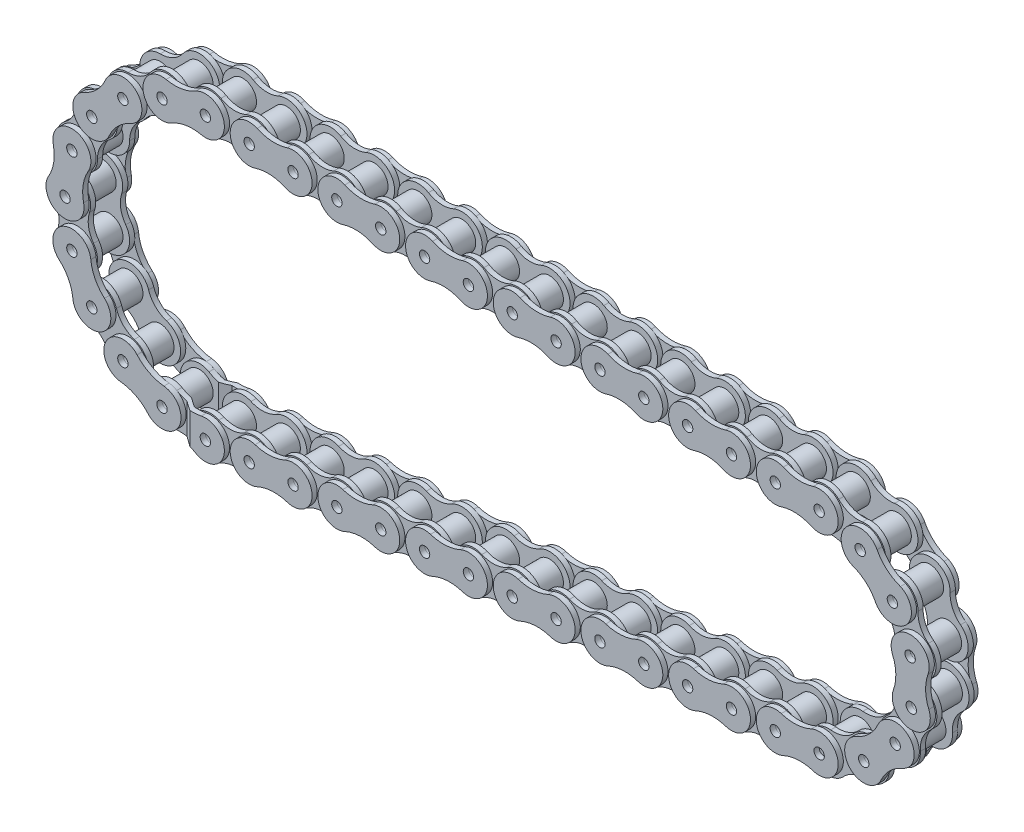
from build123d import *

# Parameters (mm, degrees)
SKETCH4_R              = 4
BOSS_EXTRUDE1_DEPTH    = 3.9
BOSS_EXTRUDE1_2_DEPTH  = 3.9
BOSS_EXTRUDE1_3_DEPTH  = 3.9
BOSS_EXTRUDE1_4_DEPTH  = 3.9
BOSS_EXTRUDE1_5_DEPTH  = 3.9
BOSS_EXTRUDE1_6_DEPTH  = 3.9
BOSS_EXTRUDE1_7_DEPTH  = 3.9
BOSS_EXTRUDE1_8_DEPTH  = 3.9
BOSS_EXTRUDE1_9_DEPTH  = 3.9
BOSS_EXTRUDE1_10_DEPTH = 3.9
BOSS_EXTRUDE1_11_DEPTH = 3.9
BOSS_EXTRUDE1_12_DEPTH = 3.9
BOSS_EXTRUDE1_13_DEPTH = 3.9
BOSS_EXTRUDE1_14_DEPTH = 3.9
BOSS_EXTRUDE1_15_DEPTH = 3.9
BOSS_EXTRUDE1_16_DEPTH = 3.9
BOSS_EXTRUDE1_17_DEPTH = 3.9
BOSS_EXTRUDE1_18_DEPTH = 3.9
BOSS_EXTRUDE1_19_DEPTH = 3.9
BOSS_EXTRUDE1_20_DEPTH = 3.9
BOSS_EXTRUDE1_21_DEPTH = 3.9
BOSS_EXTRUDE1_22_DEPTH = 3.9
BOSS_EXTRUDE1_23_DEPTH = 3.9
BOSS_EXTRUDE1_24_DEPTH = 3.9
BOSS_EXTRUDE1_25_DEPTH = 3.9
BOSS_EXTRUDE1_26_DEPTH = 3.9
BOSS_EXTRUDE1_27_DEPTH = 3.9
BOSS_EXTRUDE1_28_DEPTH = 3.9
BOSS_EXTRUDE1_29_DEPTH = 3.9
BOSS_EXTRUDE1_30_DEPTH = 3.9
BOSS_EXTRUDE1_31_DEPTH = 3.9
BOSS_EXTRUDE1_32_DEPTH = 3.9
BOSS_EXTRUDE1_33_DEPTH = 3.9
BOSS_EXTRUDE1_34_DEPTH = 3.9
BOSS_EXTRUDE1_35_DEPTH = 3.9
BOSS_EXTRUDE1_36_DEPTH = 3.9
BOSS_EXTRUDE1_37_DEPTH = 3.9
BOSS_EXTRUDE1_38_DEPTH = 3.9
BOSS_EXTRUDE1_39_DEPTH = 3.9
BOSS_EXTRUDE1_40_DEPTH = 3.9
BOSS_EXTRUDE1_41_DEPTH = 3.9
BOSS_EXTRUDE1_42_DEPTH = 3.9
BOSS_EXTRUDE1_43_DEPTH = 3.9
BOSS_EXTRUDE1_44_DEPTH = 3.9
BOSS_EXTRUDE1_45_DEPTH = 3.9
SKETCH5_R              = 1.5
BOSS_EXTRUDE2_DEPTH    = 1.5
BOSS_EXTRUDE2_2_DEPTH  = 1.5
BOSS_EXTRUDE2_3_DEPTH  = 1.5
BOSS_EXTRUDE2_4_DEPTH  = 1.5
BOSS_EXTRUDE2_5_DEPTH  = 1.5
BOSS_EXTRUDE2_6_DEPTH  = 1.5
BOSS_EXTRUDE2_7_DEPTH  = 1.5
BOSS_EXTRUDE2_8_DEPTH  = 1.5
BOSS_EXTRUDE2_9_DEPTH  = 1.5
BOSS_EXTRUDE2_10_DEPTH = 1.5
BOSS_EXTRUDE2_11_DEPTH = 1.5
BOSS_EXTRUDE2_12_DEPTH = 1.5
BOSS_EXTRUDE2_13_DEPTH = 1.5
BOSS_EXTRUDE2_14_DEPTH = 1.5
BOSS_EXTRUDE2_15_DEPTH = 1.5
BOSS_EXTRUDE2_16_DEPTH = 1.5
BOSS_EXTRUDE2_17_DEPTH = 1.5
BOSS_EXTRUDE2_18_DEPTH = 1.5
BOSS_EXTRUDE2_19_DEPTH = 1.5
BOSS_EXTRUDE2_20_DEPTH = 1.5
BOSS_EXTRUDE2_21_DEPTH = 1.5
BOSS_EXTRUDE2_22_DEPTH = 1.5
SKETCH6_R              = 1.5
BOSS_EXTRUDE3_DEPTH    = 1.5
BOSS_EXTRUDE3_2_DEPTH  = 1.5
BOSS_EXTRUDE3_3_DEPTH  = 1.5
BOSS_EXTRUDE3_4_DEPTH  = 1.5
BOSS_EXTRUDE3_5_DEPTH  = 1.5
BOSS_EXTRUDE3_6_DEPTH  = 1.5
BOSS_EXTRUDE3_7_DEPTH  = 1.5
BOSS_EXTRUDE3_8_DEPTH  = 1.5
BOSS_EXTRUDE3_9_DEPTH  = 1.5
BOSS_EXTRUDE3_10_DEPTH = 1.5
BOSS_EXTRUDE3_11_DEPTH = 1.5
BOSS_EXTRUDE3_12_DEPTH = 1.5
BOSS_EXTRUDE3_13_DEPTH = 1.5
BOSS_EXTRUDE3_14_DEPTH = 1.5
BOSS_EXTRUDE3_15_DEPTH = 1.5
BOSS_EXTRUDE3_16_DEPTH = 1.5
BOSS_EXTRUDE3_17_DEPTH = 1.5
BOSS_EXTRUDE3_18_DEPTH = 1.5
BOSS_EXTRUDE3_19_DEPTH = 1.5
BOSS_EXTRUDE3_20_DEPTH = 1.5
BOSS_EXTRUDE3_21_DEPTH = 1.5
BOSS_EXTRUDE3_22_DEPTH = 1.5
SKETCH7_R              = 1.5
BOSS_EXTRUDE4_DEPTH    = 1.5
CUT_EXTRUDE1_DEPTH     = 76


with BuildPart() as part:
    # Sketch4 → Boss-Extrude1 (new, symmetric)
    with BuildSketch(Plane.XY):
        with Locations((0, -40.59)):
            Circle(SKETCH4_R)
    extrude(amount=BOSS_EXTRUDE1_DEPTH, both=True)


with BuildPart() as body_2:
    # Sketch4 → Boss-Extrude1 2 (new, symmetric)
    with BuildSketch(Plane.XY):
        with Locations((-12.542999802, -38.603383996)):
            Circle(SKETCH4_R)
    extrude(amount=BOSS_EXTRUDE1_2_DEPTH, both=True)


with BuildPart() as body_3:
    # Sketch4 → Boss-Extrude1 3 (new, symmetric)
    with BuildSketch(Plane.XY):
        with Locations((-23.858203391, -32.837999802)):
            Circle(SKETCH4_R)
    extrude(amount=BOSS_EXTRUDE1_3_DEPTH, both=True)


with BuildPart() as body_4:
    # Sketch4 → Boss-Extrude1 4 (new, symmetric)
    with BuildSketch(Plane.XY):
        with Locations((-32.837999802, -23.858203391)):
            Circle(SKETCH4_R)
    extrude(amount=BOSS_EXTRUDE1_4_DEPTH, both=True)


with BuildPart() as body_5:
    # Sketch4 → Boss-Extrude1 5 (new, symmetric)
    with BuildSketch(Plane.XY):
        with Locations((-38.603383996, -12.542999802)):
            Circle(SKETCH4_R)
    extrude(amount=BOSS_EXTRUDE1_5_DEPTH, both=True)


with BuildPart() as body_6:
    # Sketch4 → Boss-Extrude1 6 (new, symmetric)
    with BuildSketch(Plane.XY):
        with Locations((-40.59, 0)):
            Circle(SKETCH4_R)
    extrude(amount=BOSS_EXTRUDE1_6_DEPTH, both=True)


with BuildPart() as body_7:
    # Sketch4 → Boss-Extrude1 7 (new, symmetric)
    with BuildSketch(Plane.XY):
        with Locations((-38.603383996, 12.542999802)):
            Circle(SKETCH4_R)
    extrude(amount=BOSS_EXTRUDE1_7_DEPTH, both=True)


with BuildPart() as body_8:
    # Sketch4 → Boss-Extrude1 8 (new, symmetric)
    with BuildSketch(Plane.XY):
        with Locations((-32.837999802, 23.858203391)):
            Circle(SKETCH4_R)
    extrude(amount=BOSS_EXTRUDE1_8_DEPTH, both=True)


with BuildPart() as body_9:
    # Sketch4 → Boss-Extrude1 9 (new, symmetric)
    with BuildSketch(Plane.XY):
        with Locations((-23.858203391, 32.837999802)):
            Circle(SKETCH4_R)
    extrude(amount=BOSS_EXTRUDE1_9_DEPTH, both=True)


with BuildPart() as body_10:
    # Sketch4 → Boss-Extrude1 10 (new, symmetric)
    with BuildSketch(Plane.XY):
        with Locations((-12.542999802, 38.603383996)):
            Circle(SKETCH4_R)
    extrude(amount=BOSS_EXTRUDE1_10_DEPTH, both=True)


with BuildPart() as body_11:
    # Sketch4 → Boss-Extrude1 11 (new, symmetric)
    with BuildSketch(Plane.XY):
        with Locations((0, 40.59)):
            Circle(SKETCH4_R)
    extrude(amount=BOSS_EXTRUDE1_11_DEPTH, both=True)


with BuildPart() as body_12:
    # Sketch4 → Boss-Extrude1 12 (new, symmetric)
    with BuildSketch(Plane.XY):
        with Locations((12.678180434, 39.861766629)):
            Circle(SKETCH4_R)
    extrude(amount=BOSS_EXTRUDE1_12_DEPTH, both=True)


with BuildPart() as body_13:
    # Sketch4 → Boss-Extrude1 13 (new, symmetric)
    with BuildSketch(Plane.XY):
        with Locations((25.356360868, 39.133533258)):
            Circle(SKETCH4_R)
    extrude(amount=BOSS_EXTRUDE1_13_DEPTH, both=True)


with BuildPart() as body_14:
    # Sketch4 → Boss-Extrude1 14 (new, symmetric)
    with BuildSketch(Plane.XY):
        with Locations((38.034541302, 38.405299886)):
            Circle(SKETCH4_R)
    extrude(amount=BOSS_EXTRUDE1_14_DEPTH, both=True)


with BuildPart() as body_15:
    # Sketch4 → Boss-Extrude1 15 (new, symmetric)
    with BuildSketch(Plane.XY):
        with Locations((50.712721735, 37.677066515)):
            Circle(SKETCH4_R)
    extrude(amount=BOSS_EXTRUDE1_15_DEPTH, both=True)


with BuildPart() as body_16:
    # Sketch4 → Boss-Extrude1 16 (new, symmetric)
    with BuildSketch(Plane.XY):
        with Locations((63.390902169, 36.948833144)):
            Circle(SKETCH4_R)
    extrude(amount=BOSS_EXTRUDE1_16_DEPTH, both=True)


with BuildPart() as body_17:
    # Sketch4 → Boss-Extrude1 17 (new, symmetric)
    with BuildSketch(Plane.XY):
        with Locations((76.069082603, 36.220599773)):
            Circle(SKETCH4_R)
    extrude(amount=BOSS_EXTRUDE1_17_DEPTH, both=True)


with BuildPart() as body_18:
    # Sketch4 → Boss-Extrude1 18 (new, symmetric)
    with BuildSketch(Plane.XY):
        with Locations((88.747263037, 35.492366402)):
            Circle(SKETCH4_R)
    extrude(amount=BOSS_EXTRUDE1_18_DEPTH, both=True)


with BuildPart() as body_19:
    # Sketch4 → Boss-Extrude1 19 (new, symmetric)
    with BuildSketch(Plane.XY):
        with Locations((101.425443471, 34.764133031)):
            Circle(SKETCH4_R)
    extrude(amount=BOSS_EXTRUDE1_19_DEPTH, both=True)


with BuildPart() as body_20:
    # Sketch4 → Boss-Extrude1 20 (new, symmetric)
    with BuildSketch(Plane.XY):
        with Locations((114.103623905, 34.035899659)):
            Circle(SKETCH4_R)
    extrude(amount=BOSS_EXTRUDE1_20_DEPTH, both=True)


with BuildPart() as body_21:
    # Sketch4 → Boss-Extrude1 21 (new, symmetric)
    with BuildSketch(Plane.XY):
        with Locations((126.781804338, 33.307666288)):
            Circle(SKETCH4_R)
    extrude(amount=BOSS_EXTRUDE1_21_DEPTH, both=True)


with BuildPart() as body_22:
    # Sketch4 → Boss-Extrude1 22 (new, symmetric)
    with BuildSketch(Plane.XY):
        with Locations((139.459984772, 32.579432917)):
            Circle(SKETCH4_R)
    extrude(amount=BOSS_EXTRUDE1_22_DEPTH, both=True)


with BuildPart() as body_23:
    # Sketch4 → Boss-Extrude1 23 (new, symmetric)
    with BuildSketch(Plane.XY):
        with Locations((152.138165206, 31.851199546)):
            Circle(SKETCH4_R)
    extrude(amount=BOSS_EXTRUDE1_23_DEPTH, both=True)


with BuildPart() as body_24:
    # Sketch4 → Boss-Extrude1 24 (new, symmetric)
    with BuildSketch(Plane.XY):
        with Locations((164.81634564, 31.122966175)):
            Circle(SKETCH4_R)
    extrude(amount=BOSS_EXTRUDE1_24_DEPTH, both=True)


with BuildPart() as body_25:
    # Sketch4 → Boss-Extrude1 25 (new, symmetric)
    with BuildSketch(Plane.XY):
        with Locations((177.494526074, 30.394732804)):
            Circle(SKETCH4_R)
    extrude(amount=BOSS_EXTRUDE1_25_DEPTH, both=True)


with BuildPart() as body_26:
    # Sketch4 → Boss-Extrude1 26 (new, symmetric)
    with BuildSketch(Plane.XY):
        with Locations((189.35705924, 26.502886497)):
            Circle(SKETCH4_R)
    extrude(amount=BOSS_EXTRUDE1_26_DEPTH, both=True)


with BuildPart() as body_27:
    # Sketch4 → Boss-Extrude1 27 (new, symmetric)
    with BuildSketch(Plane.XY):
        with Locations((198.673490942, 18.192034486)):
            Circle(SKETCH4_R)
    extrude(amount=BOSS_EXTRUDE1_27_DEPTH, both=True)


with BuildPart() as body_28:
    # Sketch4 → Boss-Extrude1 28 (new, symmetric)
    with BuildSketch(Plane.XY):
        with Locations((203.889136946, 6.849054386)):
            Circle(SKETCH4_R)
    extrude(amount=BOSS_EXTRUDE1_28_DEPTH, both=True)


with BuildPart() as body_29:
    # Sketch4 → Boss-Extrude1 29 (new, symmetric)
    with BuildSketch(Plane.XY):
        with Locations((204.1336337, -5.633188287)):
            Circle(SKETCH4_R)
    extrude(amount=BOSS_EXTRUDE1_29_DEPTH, both=True)


with BuildPart() as body_30:
    # Sketch4 → Boss-Extrude1 30 (new, symmetric)
    with BuildSketch(Plane.XY):
        with Locations((199.366180684, -17.171712999)):
            Circle(SKETCH4_R)
    extrude(amount=BOSS_EXTRUDE1_30_DEPTH, both=True)


with BuildPart() as body_31:
    # Sketch4 → Boss-Extrude1 31 (new, symmetric)
    with BuildSketch(Plane.XY):
        with Locations((190.382349021, -25.841022629)):
            Circle(SKETCH4_R)
    extrude(amount=BOSS_EXTRUDE1_31_DEPTH, both=True)


with BuildPart() as body_32:
    # Sketch4 → Boss-Extrude1 32 (new, symmetric)
    with BuildSketch(Plane.XY):
        with Locations((164.81634564, -31.122966175)):
            Circle(SKETCH4_R)
    extrude(amount=BOSS_EXTRUDE1_32_DEPTH, both=True)


with BuildPart() as body_33:
    # Sketch4 → Boss-Extrude1 33 (new, symmetric)
    with BuildSketch(Plane.XY):
        with Locations((152.138165206, -31.851199546)):
            Circle(SKETCH4_R)
    extrude(amount=BOSS_EXTRUDE1_33_DEPTH, both=True)


with BuildPart() as body_34:
    # Sketch4 → Boss-Extrude1 34 (new, symmetric)
    with BuildSketch(Plane.XY):
        with Locations((139.459984772, -32.579432917)):
            Circle(SKETCH4_R)
    extrude(amount=BOSS_EXTRUDE1_34_DEPTH, both=True)


with BuildPart() as body_35:
    # Sketch4 → Boss-Extrude1 35 (new, symmetric)
    with BuildSketch(Plane.XY):
        with Locations((126.781804338, -33.307666288)):
            Circle(SKETCH4_R)
    extrude(amount=BOSS_EXTRUDE1_35_DEPTH, both=True)


with BuildPart() as body_36:
    # Sketch4 → Boss-Extrude1 36 (new, symmetric)
    with BuildSketch(Plane.XY):
        with Locations((114.103623905, -34.035899659)):
            Circle(SKETCH4_R)
    extrude(amount=BOSS_EXTRUDE1_36_DEPTH, both=True)


with BuildPart() as body_37:
    # Sketch4 → Boss-Extrude1 37 (new, symmetric)
    with BuildSketch(Plane.XY):
        with Locations((101.425443471, -34.764133031)):
            Circle(SKETCH4_R)
    extrude(amount=BOSS_EXTRUDE1_37_DEPTH, both=True)


with BuildPart() as body_38:
    # Sketch4 → Boss-Extrude1 38 (new, symmetric)
    with BuildSketch(Plane.XY):
        with Locations((88.747263037, -35.492366402)):
            Circle(SKETCH4_R)
    extrude(amount=BOSS_EXTRUDE1_38_DEPTH, both=True)


with BuildPart() as body_39:
    # Sketch4 → Boss-Extrude1 39 (new, symmetric)
    with BuildSketch(Plane.XY):
        with Locations((76.069082603, -36.220599773)):
            Circle(SKETCH4_R)
    extrude(amount=BOSS_EXTRUDE1_39_DEPTH, both=True)


with BuildPart() as body_40:
    # Sketch4 → Boss-Extrude1 40 (new, symmetric)
    with BuildSketch(Plane.XY):
        with Locations((63.390902169, -36.948833144)):
            Circle(SKETCH4_R)
    extrude(amount=BOSS_EXTRUDE1_40_DEPTH, both=True)


with BuildPart() as body_41:
    # Sketch4 → Boss-Extrude1 41 (new, symmetric)
    with BuildSketch(Plane.XY):
        with Locations((50.712721735, -37.677066515)):
            Circle(SKETCH4_R)
    extrude(amount=BOSS_EXTRUDE1_41_DEPTH, both=True)


with BuildPart() as body_42:
    # Sketch4 → Boss-Extrude1 42 (new, symmetric)
    with BuildSketch(Plane.XY):
        with Locations((38.034541302, -38.405299886)):
            Circle(SKETCH4_R)
    extrude(amount=BOSS_EXTRUDE1_42_DEPTH, both=True)


with BuildPart() as body_43:
    # Sketch4 → Boss-Extrude1 43 (new, symmetric)
    with BuildSketch(Plane.XY):
        with Locations((25.356360868, -39.133533258)):
            Circle(SKETCH4_R)
    extrude(amount=BOSS_EXTRUDE1_43_DEPTH, both=True)


with BuildPart() as body_44:
    # Sketch4 → Boss-Extrude1 44 (new, symmetric)
    with BuildSketch(Plane.XY):
        with Locations((12.678180434, -39.861766629)):
            Circle(SKETCH4_R)
    extrude(amount=BOSS_EXTRUDE1_44_DEPTH, both=True)


with BuildPart() as body_45:
    # Sketch4 → Boss-Extrude1 45 (new, symmetric)
    with BuildSketch(Plane.XY):
        with Locations((178.681320145, -30.194421765)):
            Circle(SKETCH4_R)
    extrude(amount=BOSS_EXTRUDE1_45_DEPTH, both=True)


with BuildPart() as body_46:
    # Sketch5 → Boss-Extrude2 (new body)
    with BuildSketch(Plane.XY.offset(3.9)):
        with BuildLine():
            ThreePointArc((2.991667607, 45.675265473), (-5.89029096, 40.928337703), (2.389718332, 35.195628276))
            ThreePointArc((2.389718332, 35.195628276), (6.088777363, 35.86806114), (9.686512826, 34.776501156))
            ThreePointArc((9.686512826, 34.776501156), (18.568471394, 39.523428926), (10.288462102, 45.256138352))
            ThreePointArc((10.288462102, 45.256138352), (6.589403071, 44.583705489), (2.991667607, 45.675265473))
        make_face()
        with Locations((0, 40.59)):
            Circle(SKETCH5_R, mode=Mode.SUBTRACT)
        with Locations((12.678180434, 39.861766629)):
            Circle(SKETCH5_R, mode=Mode.SUBTRACT)
    extrude(amount=BOSS_EXTRUDE2_DEPTH)


with BuildPart() as body_47:
    # Sketch5 → Boss-Extrude2 2 (new body)
    with BuildSketch(Plane.XY.offset(3.9)):
        with BuildLine():
            ThreePointArc((28.348028475, 44.21879873), (19.466069907, 39.47187096), (27.7460792, 33.739161534))
            ThreePointArc((27.7460792, 33.739161534), (31.44513823, 34.411594397), (35.042873694, 33.320034414))
            ThreePointArc((35.042873694, 33.320034414), (43.924832262, 38.066962184), (35.644822969, 43.79967161))
            ThreePointArc((35.644822969, 43.79967161), (31.945763939, 43.127238747), (28.348028475, 44.21879873))
        make_face()
        with Locations((25.356360868, 39.133533258)):
            Circle(SKETCH5_R, mode=Mode.SUBTRACT)
        with Locations((38.034541302, 38.405299886)):
            Circle(SKETCH5_R, mode=Mode.SUBTRACT)
    extrude(amount=BOSS_EXTRUDE2_2_DEPTH)


with BuildPart() as body_48:
    # Sketch5 → Boss-Extrude2 3 (new body)
    with BuildSketch(Plane.XY.offset(3.9)):
        with BuildLine():
            ThreePointArc((53.704389343, 42.762331988), (44.822430775, 38.015404218), (53.102440067, 32.282694792))
            ThreePointArc((53.102440067, 32.282694792), (56.801499098, 32.955127655), (60.399234562, 31.863567672))
            ThreePointArc((60.399234562, 31.863567672), (69.28119313, 36.610495441), (61.001183837, 42.343204868))
            ThreePointArc((61.001183837, 42.343204868), (57.302124807, 41.670772004), (53.704389343, 42.762331988))
        make_face()
        with Locations((50.712721735, 37.677066515)):
            Circle(SKETCH5_R, mode=Mode.SUBTRACT)
        with Locations((63.390902169, 36.948833144)):
            Circle(SKETCH5_R, mode=Mode.SUBTRACT)
    extrude(amount=BOSS_EXTRUDE2_3_DEPTH)


with BuildPart() as body_49:
    # Sketch5 → Boss-Extrude2 4 (new body)
    with BuildSketch(Plane.XY.offset(3.9)):
        with BuildLine():
            ThreePointArc((79.06075021, 41.305865246), (70.178791643, 36.558937476), (78.458800935, 30.826228049))
            ThreePointArc((78.458800935, 30.826228049), (82.157859966, 31.498660913), (85.755595429, 30.407100929))
            ThreePointArc((85.755595429, 30.407100929), (94.637553997, 35.154028699), (86.357544705, 40.886738125))
            ThreePointArc((86.357544705, 40.886738125), (82.658485674, 40.214305262), (79.06075021, 41.305865246))
        make_face()
        with Locations((76.069082603, 36.220599773)):
            Circle(SKETCH5_R, mode=Mode.SUBTRACT)
        with Locations((88.747263037, 35.492366402)):
            Circle(SKETCH5_R, mode=Mode.SUBTRACT)
    extrude(amount=BOSS_EXTRUDE2_4_DEPTH)


with BuildPart() as body_50:
    # Sketch5 → Boss-Extrude2 5 (new body)
    with BuildSketch(Plane.XY.offset(3.9)):
        with BuildLine():
            ThreePointArc((104.417111078, 39.849398503), (95.53515251, 35.102470733), (103.815161803, 29.369761307))
            ThreePointArc((103.815161803, 29.369761307), (107.514220833, 30.04219417), (111.111956297, 28.950634187))
            ThreePointArc((111.111956297, 28.950634187), (119.993914865, 33.697561957), (111.713905572, 39.430271383))
            ThreePointArc((111.713905572, 39.430271383), (108.014846542, 38.75783852), (104.417111078, 39.849398503))
        make_face()
        with Locations((101.425443471, 34.764133031)):
            Circle(SKETCH5_R, mode=Mode.SUBTRACT)
        with Locations((114.103623905, 34.035899659)):
            Circle(SKETCH5_R, mode=Mode.SUBTRACT)
    extrude(amount=BOSS_EXTRUDE2_5_DEPTH)


with BuildPart() as body_51:
    # Sketch5 → Boss-Extrude2 6 (new body)
    with BuildSketch(Plane.XY.offset(3.9)):
        with BuildLine():
            ThreePointArc((129.773471946, 38.392931761), (120.891513378, 33.646003991), (129.17152267, 27.913294565))
            ThreePointArc((129.17152267, 27.913294565), (132.870581701, 28.585727428), (136.468317165, 27.494167445))
            ThreePointArc((136.468317165, 27.494167445), (145.350275733, 32.241095214), (137.07026644, 37.973804641))
            ThreePointArc((137.07026644, 37.973804641), (133.37120741, 37.301371777), (129.773471946, 38.392931761))
        make_face()
        with Locations((126.781804338, 33.307666288)):
            Circle(SKETCH5_R, mode=Mode.SUBTRACT)
        with Locations((139.459984772, 32.579432917)):
            Circle(SKETCH5_R, mode=Mode.SUBTRACT)
    extrude(amount=BOSS_EXTRUDE2_6_DEPTH)


with BuildPart() as body_52:
    # Sketch5 → Boss-Extrude2 7 (new body)
    with BuildSketch(Plane.XY.offset(3.9)):
        with BuildLine():
            ThreePointArc((155.129832813, 36.936465019), (146.247874246, 32.189537249), (154.527883538, 26.456827822))
            ThreePointArc((154.527883538, 26.456827822), (158.226942569, 27.129260686), (161.824678032, 26.037700702))
            ThreePointArc((161.824678032, 26.037700702), (170.7066366, 30.784628472), (162.426627308, 36.517337898))
            ThreePointArc((162.426627308, 36.517337898), (158.727568277, 35.844905035), (155.129832813, 36.936465019))
        make_face()
        with Locations((152.138165206, 31.851199546)):
            Circle(SKETCH5_R, mode=Mode.SUBTRACT)
        with Locations((164.81634564, 31.122966175)):
            Circle(SKETCH5_R, mode=Mode.SUBTRACT)
    extrude(amount=BOSS_EXTRUDE2_7_DEPTH)


with BuildPart() as body_53:
    # Sketch5 → Boss-Extrude2 8 (new body)
    with BuildSketch(Plane.XY.offset(3.9)):
        with BuildLine():
            ThreePointArc((154.527883538, -26.456827822), (158.226942569, -27.129260686), (161.824678032, -26.037700702))
            ThreePointArc((161.824678032, -26.037700702), (170.7066366, -30.784628472), (162.426627308, -36.517337898))
            ThreePointArc((162.426627308, -36.517337898), (158.727568277, -35.844905035), (155.129832813, -36.936465019))
            ThreePointArc((155.129832813, -36.936465019), (146.247874246, -32.189537249), (154.527883538, -26.456827822))
        make_face()
        with Locations((164.81634564, -31.122966175)):
            Circle(SKETCH5_R, mode=Mode.SUBTRACT)
        with Locations((152.138165206, -31.851199546)):
            Circle(SKETCH5_R, mode=Mode.SUBTRACT)
    extrude(amount=BOSS_EXTRUDE2_8_DEPTH)


with BuildPart() as body_54:
    # Sketch5 → Boss-Extrude2 9 (new body)
    with BuildSketch(Plane.XY.offset(3.9)):
        with BuildLine():
            ThreePointArc((129.17152267, -27.913294565), (132.870581701, -28.585727428), (136.468317165, -27.494167445))
            ThreePointArc((136.468317165, -27.494167445), (145.350275733, -32.241095214), (137.07026644, -37.973804641))
            ThreePointArc((137.07026644, -37.973804641), (133.37120741, -37.301371777), (129.773471946, -38.392931761))
            ThreePointArc((129.773471946, -38.392931761), (120.891513378, -33.646003991), (129.17152267, -27.913294565))
        make_face()
        with Locations((139.459984772, -32.579432917)):
            Circle(SKETCH5_R, mode=Mode.SUBTRACT)
        with Locations((126.781804338, -33.307666288)):
            Circle(SKETCH5_R, mode=Mode.SUBTRACT)
    extrude(amount=BOSS_EXTRUDE2_9_DEPTH)


with BuildPart() as body_55:
    # Sketch5 → Boss-Extrude2 10 (new body)
    with BuildSketch(Plane.XY.offset(3.9)):
        with BuildLine():
            ThreePointArc((103.815161803, -29.369761307), (107.514220833, -30.04219417), (111.111956297, -28.950634187))
            ThreePointArc((111.111956297, -28.950634187), (119.993914865, -33.697561957), (111.713905572, -39.430271383))
            ThreePointArc((111.713905572, -39.430271383), (108.014846542, -38.75783852), (104.417111078, -39.849398503))
            ThreePointArc((104.417111078, -39.849398503), (95.53515251, -35.102470733), (103.815161803, -29.369761307))
        make_face()
        with Locations((114.103623905, -34.035899659)):
            Circle(SKETCH5_R, mode=Mode.SUBTRACT)
        with Locations((101.425443471, -34.764133031)):
            Circle(SKETCH5_R, mode=Mode.SUBTRACT)
    extrude(amount=BOSS_EXTRUDE2_10_DEPTH)


with BuildPart() as body_56:
    # Sketch5 → Boss-Extrude2 11 (new body)
    with BuildSketch(Plane.XY.offset(3.9)):
        with BuildLine():
            ThreePointArc((78.458800935, -30.826228049), (82.157859966, -31.498660913), (85.755595429, -30.407100929))
            ThreePointArc((85.755595429, -30.407100929), (94.637553997, -35.154028699), (86.357544705, -40.886738125))
            ThreePointArc((86.357544705, -40.886738125), (82.658485674, -40.214305262), (79.06075021, -41.305865246))
            ThreePointArc((79.06075021, -41.305865246), (70.178791643, -36.558937476), (78.458800935, -30.826228049))
        make_face()
        with Locations((88.747263037, -35.492366402)):
            Circle(SKETCH5_R, mode=Mode.SUBTRACT)
        with Locations((76.069082603, -36.220599773)):
            Circle(SKETCH5_R, mode=Mode.SUBTRACT)
    extrude(amount=BOSS_EXTRUDE2_11_DEPTH)


with BuildPart() as body_57:
    # Sketch5 → Boss-Extrude2 12 (new body)
    with BuildSketch(Plane.XY.offset(3.9)):
        with BuildLine():
            ThreePointArc((53.102440067, -32.282694792), (56.801499098, -32.955127655), (60.399234562, -31.863567672))
            ThreePointArc((60.399234562, -31.863567672), (69.28119313, -36.610495441), (61.001183837, -42.343204868))
            ThreePointArc((61.001183837, -42.343204868), (57.302124807, -41.670772004), (53.704389343, -42.762331988))
            ThreePointArc((53.704389343, -42.762331988), (44.822430775, -38.015404218), (53.102440067, -32.282694792))
        make_face()
        with Locations((63.390902169, -36.948833144)):
            Circle(SKETCH5_R, mode=Mode.SUBTRACT)
        with Locations((50.712721735, -37.677066515)):
            Circle(SKETCH5_R, mode=Mode.SUBTRACT)
    extrude(amount=BOSS_EXTRUDE2_12_DEPTH)


with BuildPart() as body_58:
    # Sketch5 → Boss-Extrude2 13 (new body)
    with BuildSketch(Plane.XY.offset(3.9)):
        with BuildLine():
            ThreePointArc((27.7460792, -33.739161534), (31.44513823, -34.411594397), (35.042873694, -33.320034414))
            ThreePointArc((35.042873694, -33.320034414), (43.924832262, -38.066962184), (35.644822969, -43.79967161))
            ThreePointArc((35.644822969, -43.79967161), (31.945763939, -43.127238747), (28.348028475, -44.21879873))
            ThreePointArc((28.348028475, -44.21879873), (19.466069907, -39.47187096), (27.7460792, -33.739161534))
        make_face()
        with Locations((38.034541302, -38.405299886)):
            Circle(SKETCH5_R, mode=Mode.SUBTRACT)
        with Locations((25.356360868, -39.133533258)):
            Circle(SKETCH5_R, mode=Mode.SUBTRACT)
    extrude(amount=BOSS_EXTRUDE2_13_DEPTH)


with BuildPart() as body_59:
    # Sketch5 → Boss-Extrude2 14 (new body)
    with BuildSketch(Plane.XY.offset(3.9)):
        with BuildLine():
            ThreePointArc((2.389718332, -35.195628276), (6.088777363, -35.86806114), (9.686512826, -34.776501156))
            ThreePointArc((9.686512826, -34.776501156), (18.568471394, -39.523428926), (10.288462102, -45.256138352))
            ThreePointArc((10.288462102, -45.256138352), (6.589403071, -44.583705489), (2.991667607, -45.675265473))
            ThreePointArc((2.991667607, -45.675265473), (-5.89029096, -40.928337703), (2.389718332, -35.195628276))
        make_face()
        with Locations((12.678180434, -39.861766629)):
            Circle(SKETCH5_R, mode=Mode.SUBTRACT)
        with Locations((0, -40.59)):
            Circle(SKETCH5_R, mode=Mode.SUBTRACT)
    extrude(amount=BOSS_EXTRUDE2_14_DEPTH)


with BuildPart() as body_60:
    # Sketch5 → Boss-Extrude2 15 (new body)
    with BuildSketch(Plane.XY.offset(3.9)):
        with BuildLine():
            ThreePointArc((181.655427281, 34.577662535), (171.88852041, 32.233944727), (178.368800815, 24.559868308))
            ThreePointArc((178.368800815, 24.559868308), (182.048104766, 24.249551249), (185.196158033, 22.319956765))
            ThreePointArc((185.196158033, 22.319956765), (194.963064904, 24.663674574), (188.482784499, 32.337750992))
            ThreePointArc((188.482784499, 32.337750992), (184.803480548, 32.648068052), (181.655427281, 34.577662535))
        make_face()
        with Locations((177.494526074, 30.394732804)):
            Circle(SKETCH5_R, mode=Mode.SUBTRACT)
        with Locations((189.35705924, 26.502886497)):
            Circle(SKETCH5_R, mode=Mode.SUBTRACT)
    extrude(amount=BOSS_EXTRUDE2_15_DEPTH)


with BuildPart() as body_61:
    # Sketch5 → Boss-Extrude2 16 (new body)
    with BuildSketch(Plane.XY.offset(3.9)):
        with BuildLine():
            ThreePointArc((204.569926969, 17.986992608), (196.20867667, 23.552509335), (194.990890268, 13.582430134))
            ThreePointArc((194.990890268, 13.582430134), (197.265973897, 10.674240194), (197.992700919, 7.054096263))
            ThreePointArc((197.992700919, 7.054096263), (206.353951217, 1.488579536), (207.571737619, 11.458658737))
            ThreePointArc((207.571737619, 11.458658737), (205.296653991, 14.366848677), (204.569926969, 17.986992608))
        make_face()
        with Locations((198.673490942, 18.192034486)):
            Circle(SKETCH5_R, mode=Mode.SUBTRACT)
        with Locations((203.889136946, 6.849054386)):
            Circle(SKETCH5_R, mode=Mode.SUBTRACT)
    extrude(amount=BOSS_EXTRUDE2_16_DEPTH)


with BuildPart() as body_62:
    # Sketch5 → Boss-Extrude2 17 (new body)
    with BuildSketch(Plane.XY.offset(3.9)):
        with BuildLine():
            ThreePointArc((207.993922232, -10.095045798), (206.386640561, -0.180302805), (198.249750002, -6.068977956))
            ThreePointArc((198.249750002, -6.068977956), (197.665345643, -9.714803759), (195.505892151, -12.709855488))
            ThreePointArc((195.505892151, -12.709855488), (197.113173823, -22.624598482), (205.250064381, -16.73592333))
            ThreePointArc((205.250064381, -16.73592333), (205.83446874, -13.090097527), (207.993922232, -10.095045798))
        make_face()
        with Locations((204.1336337, -5.633188287)):
            Circle(SKETCH5_R, mode=Mode.SUBTRACT)
        with Locations((199.366180684, -17.171712999)):
            Circle(SKETCH5_R, mode=Mode.SUBTRACT)
    extrude(amount=BOSS_EXTRUDE2_17_DEPTH)


with BuildPart() as body_63:
    # Sketch5 → Boss-Extrude2 18 (new body)
    with BuildSketch(Plane.XY.offset(3.9)):
        with BuildLine():
            ThreePointArc((189.737238815, -31.705648177), (195.912030854, -23.783689691), (186.060835459, -21.824242757))
            ThreePointArc((186.060835459, -21.824242757), (182.990760038, -23.875635248), (179.326430351, -24.329796217))
            ThreePointArc((179.326430351, -24.329796217), (173.151638311, -32.251754703), (183.002833706, -34.211201637))
            ThreePointArc((183.002833706, -34.211201637), (186.072909127, -32.159809146), (189.737238815, -31.705648177))
        make_face()
        with Locations((190.382349021, -25.841022629)):
            Circle(SKETCH5_R, mode=Mode.SUBTRACT)
        with Locations((178.681320145, -30.194421765)):
            Circle(SKETCH5_R, mode=Mode.SUBTRACT)
    extrude(amount=BOSS_EXTRUDE2_18_DEPTH)


with BuildPart() as body_64:
    # Sketch5 → Boss-Extrude2 19 (new body)
    with BuildSketch(Plane.XY.offset(3.9)):
        with BuildLine():
            ThreePointArc((-12.561692436, 32.703413608), (-7.286061309, 41.281927945), (-17.327163367, 42.056176921))
            ThreePointArc((-17.327163367, 42.056176921), (-20.182240814, 39.609877846), (-23.839510756, 38.73797019))
            ThreePointArc((-23.839510756, 38.73797019), (-29.115141883, 30.159455853), (-19.074039825, 29.385206877))
            ThreePointArc((-19.074039825, 29.385206877), (-16.218962379, 31.831505953), (-12.561692436, 32.703413608))
        make_face()
        with Locations((-12.542999802, 38.603383996)):
            Circle(SKETCH5_R, mode=Mode.SUBTRACT)
        with Locations((-23.858203391, 32.837999802)):
            Circle(SKETCH5_R, mode=Mode.SUBTRACT)
    extrude(amount=BOSS_EXTRUDE2_19_DEPTH)


with BuildPart() as body_65:
    # Sketch5 → Boss-Extrude2 20 (new body)
    with BuildSketch(Plane.XY.offset(3.9)):
        with BuildLine():
            ThreePointArc((-29.385206877, 19.074039825), (-30.159455853, 29.115141883), (-38.73797019, 23.839510756))
            ThreePointArc((-38.73797019, 23.839510756), (-39.609877846, 20.182240814), (-42.056176921, 17.327163367))
            ThreePointArc((-42.056176921, 17.327163367), (-41.281927945, 7.286061309), (-32.703413608, 12.561692436))
            ThreePointArc((-32.703413608, 12.561692436), (-31.831505953, 16.218962379), (-29.385206877, 19.074039825))
        make_face()
        with Locations((-32.837999802, 23.858203391)):
            Circle(SKETCH5_R, mode=Mode.SUBTRACT)
        with Locations((-38.603383996, 12.542999802)):
            Circle(SKETCH5_R, mode=Mode.SUBTRACT)
    extrude(amount=BOSS_EXTRUDE2_20_DEPTH)


with BuildPart() as body_66:
    # Sketch5 → Boss-Extrude2 21 (new body)
    with BuildSketch(Plane.XY.offset(3.9)):
        with BuildLine():
            ThreePointArc((-34.984571058, -1.840968868), (-41.512963344, 5.82736121), (-45.352189056, -3.483038242))
            ThreePointArc((-45.352189056, -3.483038242), (-43.907887831, -6.95432624), (-44.208812939, -10.702030934))
            ThreePointArc((-44.208812939, -10.702030934), (-37.680420653, -18.370361011), (-33.841194941, -9.05996156))
            ThreePointArc((-33.841194941, -9.05996156), (-35.285496166, -5.588673562), (-34.984571058, -1.840968868))
        make_face()
        with Locations((-40.59, 0)):
            Circle(SKETCH5_R, mode=Mode.SUBTRACT)
        with Locations((-38.603383996, -12.542999802)):
            Circle(SKETCH5_R, mode=Mode.SUBTRACT)
    extrude(amount=BOSS_EXTRUDE2_21_DEPTH)


with BuildPart() as body_67:
    # Sketch5 → Boss-Extrude2 22 (new body)
    with BuildSketch(Plane.XY.offset(3.9)):
        with BuildLine():
            ThreePointArc((-27.221018176, -22.052790026), (-37.009929811, -19.686273382), (-34.643413166, -29.475185016))
            ThreePointArc((-34.643413166, -29.475185016), (-31.434577039, -31.434577039), (-29.475185016, -34.643413166))
            ThreePointArc((-29.475185016, -34.643413166), (-19.686273382, -37.009929811), (-22.052790026, -27.221018176))
            ThreePointArc((-22.052790026, -27.221018176), (-25.261626154, -25.261626154), (-27.221018176, -22.052790026))
        make_face()
        with Locations((-32.837999802, -23.858203391)):
            Circle(SKETCH5_R, mode=Mode.SUBTRACT)
        with Locations((-23.858203391, -32.837999802)):
            Circle(SKETCH5_R, mode=Mode.SUBTRACT)
    extrude(amount=BOSS_EXTRUDE2_22_DEPTH)


with BuildPart() as body_68:
    # Sketch6 → Boss-Extrude3 (new body)
    with BuildSketch(Plane.XY.offset(5.4)):
        with BuildLine():
            ThreePointArc((-11.373712717, 43.977653036), (-17.975285675, 37.742994439), (-9.770201235, 33.853479986))
            ThreePointArc((-9.770201235, 33.853479986), (-5.597672487, 35.342313142), (-1.169287085, 35.21573096))
            ThreePointArc((-1.169287085, 35.21573096), (5.432285873, 41.450389558), (-2.772798567, 45.33990401))
            ThreePointArc((-2.772798567, 45.33990401), (-6.945327315, 43.851070854), (-11.373712717, 43.977653036))
        make_face()
        with Locations((0, 40.59)):
            Circle(SKETCH6_R, mode=Mode.SUBTRACT)
        with Locations((-12.542999802, 38.603383996)):
            Circle(SKETCH6_R, mode=Mode.SUBTRACT)
    extrude(amount=BOSS_EXTRUDE3_DEPTH)


with BuildPart() as body_69:
    # Sketch6 → Boss-Extrude3 2 (new body)
    with BuildSketch(Plane.XY.offset(5.4)):
        with BuildLine():
            ThreePointArc((14.964372593, 44.864098626), (7.187231233, 40.177166182), (14.376559268, 34.630561286))
            ThreePointArc((14.376559268, 34.630561286), (18.770257568, 35.197275158), (23.070168708, 34.13120126))
            ThreePointArc((23.070168708, 34.13120126), (30.847310068, 38.818133704), (23.657982033, 44.3647386))
            ThreePointArc((23.657982033, 44.3647386), (19.264283733, 43.798024728), (14.964372593, 44.864098626))
        make_face()
        with Locations((25.356360868, 39.133533258)):
            Circle(SKETCH6_R, mode=Mode.SUBTRACT)
        with Locations((12.678180434, 39.861766629)):
            Circle(SKETCH6_R, mode=Mode.SUBTRACT)
    extrude(amount=BOSS_EXTRUDE3_2_DEPTH)


with BuildPart() as body_70:
    # Sketch6 → Boss-Extrude3 3 (new body)
    with BuildSketch(Plane.XY.offset(5.4)):
        with BuildLine():
            ThreePointArc((40.320733461, 43.407631884), (32.543592101, 38.72069944), (39.732920136, 33.174094544))
            ThreePointArc((39.732920136, 33.174094544), (44.126618436, 33.740808416), (48.426529576, 32.674734518))
            ThreePointArc((48.426529576, 32.674734518), (56.203670936, 37.361666962), (49.014342901, 42.908271858))
            ThreePointArc((49.014342901, 42.908271858), (44.620644601, 42.341557986), (40.320733461, 43.407631884))
        make_face()
        with Locations((50.712721735, 37.677066515)):
            Circle(SKETCH6_R, mode=Mode.SUBTRACT)
        with Locations((38.034541302, 38.405299886)):
            Circle(SKETCH6_R, mode=Mode.SUBTRACT)
    extrude(amount=BOSS_EXTRUDE3_3_DEPTH)


with BuildPart() as body_71:
    # Sketch6 → Boss-Extrude3 4 (new body)
    with BuildSketch(Plane.XY.offset(5.4)):
        with BuildLine():
            ThreePointArc((65.677094328, 41.951165141), (57.899952969, 37.264232698), (65.089281003, 31.717627802))
            ThreePointArc((65.089281003, 31.717627802), (69.482979304, 32.284341673), (73.782890444, 31.218267776))
            ThreePointArc((73.782890444, 31.218267776), (81.560031803, 35.90520022), (74.370703769, 41.451805115))
            ThreePointArc((74.370703769, 41.451805115), (69.977005468, 40.885091244), (65.677094328, 41.951165141))
        make_face()
        with Locations((76.069082603, 36.220599773)):
            Circle(SKETCH6_R, mode=Mode.SUBTRACT)
        with Locations((63.390902169, 36.948833144)):
            Circle(SKETCH6_R, mode=Mode.SUBTRACT)
    extrude(amount=BOSS_EXTRUDE3_4_DEPTH)


with BuildPart() as body_72:
    # Sketch6 → Boss-Extrude3 5 (new body)
    with BuildSketch(Plane.XY.offset(5.4)):
        with BuildLine():
            ThreePointArc((91.033455196, 40.494698399), (83.256313836, 35.807765955), (90.445641871, 30.261161059))
            ThreePointArc((90.445641871, 30.261161059), (94.839340171, 30.827874931), (99.139251311, 29.761801033))
            ThreePointArc((99.139251311, 29.761801033), (106.916392671, 34.448733477), (99.727064636, 39.995338373))
            ThreePointArc((99.727064636, 39.995338373), (95.333366336, 39.428624501), (91.033455196, 40.494698399))
        make_face()
        with Locations((101.425443471, 34.764133031)):
            Circle(SKETCH6_R, mode=Mode.SUBTRACT)
        with Locations((88.747263037, 35.492366402)):
            Circle(SKETCH6_R, mode=Mode.SUBTRACT)
    extrude(amount=BOSS_EXTRUDE3_5_DEPTH)


with BuildPart() as body_73:
    # Sketch6 → Boss-Extrude3 6 (new body)
    with BuildSketch(Plane.XY.offset(5.4)):
        with BuildLine():
            ThreePointArc((116.389816064, 39.038231657), (108.612674704, 34.351299213), (115.802002739, 28.804694317))
            ThreePointArc((115.802002739, 28.804694317), (120.195701039, 29.371408189), (124.495612179, 28.305334291))
            ThreePointArc((124.495612179, 28.305334291), (132.272753539, 32.992266735), (125.083425504, 38.538871631))
            ThreePointArc((125.083425504, 38.538871631), (120.689727204, 37.972157759), (116.389816064, 39.038231657))
        make_face()
        with Locations((126.781804338, 33.307666288)):
            Circle(SKETCH6_R, mode=Mode.SUBTRACT)
        with Locations((114.103623905, 34.035899659)):
            Circle(SKETCH6_R, mode=Mode.SUBTRACT)
    extrude(amount=BOSS_EXTRUDE3_6_DEPTH)


with BuildPart() as body_74:
    # Sketch6 → Boss-Extrude3 7 (new body)
    with BuildSketch(Plane.XY.offset(5.4)):
        with BuildLine():
            ThreePointArc((141.746176931, 37.581764914), (133.969035572, 32.894832471), (141.158363606, 27.348227575))
            ThreePointArc((141.158363606, 27.348227575), (145.552061907, 27.914941446), (149.851973047, 26.848867549))
            ThreePointArc((149.851973047, 26.848867549), (157.629114406, 31.535799992), (150.439786372, 37.082404888))
            ThreePointArc((150.439786372, 37.082404888), (146.046088071, 36.515691017), (141.746176931, 37.581764914))
        make_face()
        with Locations((152.138165206, 31.851199546)):
            Circle(SKETCH6_R, mode=Mode.SUBTRACT)
        with Locations((139.459984772, 32.579432917)):
            Circle(SKETCH6_R, mode=Mode.SUBTRACT)
    extrude(amount=BOSS_EXTRUDE3_7_DEPTH)


with BuildPart() as body_75:
    # Sketch6 → Boss-Extrude3 8 (new body)
    with BuildSketch(Plane.XY.offset(5.4)):
        with BuildLine():
            ThreePointArc((167.102537799, 36.125298172), (159.325396439, 31.438365728), (166.514724474, 25.891760832))
            ThreePointArc((166.514724474, 25.891760832), (170.908422774, 26.458474704), (175.208333914, 25.392400806))
            ThreePointArc((175.208333914, 25.392400806), (182.985475274, 30.07933325), (175.796147239, 35.625938146))
            ThreePointArc((175.796147239, 35.625938146), (171.402448939, 35.059224274), (167.102537799, 36.125298172))
        make_face()
        with Locations((177.494526074, 30.394732804)):
            Circle(SKETCH6_R, mode=Mode.SUBTRACT)
        with Locations((164.81634564, 31.122966175)):
            Circle(SKETCH6_R, mode=Mode.SUBTRACT)
    extrude(amount=BOSS_EXTRUDE3_8_DEPTH)


with BuildPart() as body_76:
    # Sketch6 → Boss-Extrude3 9 (new body)
    with BuildSketch(Plane.XY.offset(5.4)):
        with BuildLine():
            ThreePointArc((175.208333914, -25.392400806), (170.908422774, -26.458474704), (166.514724474, -25.891760832))
            ThreePointArc((166.514724474, -25.891760832), (159.325396439, -31.438365728), (167.102537799, -36.125298172))
            ThreePointArc((167.102537799, -36.125298172), (171.402448939, -35.059224274), (175.796147239, -35.625938146))
            ThreePointArc((175.796147239, -35.625938146), (182.985475274, -30.07933325), (175.208333914, -25.392400806))
        make_face()
        with Locations((164.81634564, -31.122966175)):
            Circle(SKETCH6_R, mode=Mode.SUBTRACT)
        with Locations((177.494526074, -30.394732804)):
            Circle(SKETCH6_R, mode=Mode.SUBTRACT)
    extrude(amount=BOSS_EXTRUDE3_9_DEPTH)


with BuildPart() as body_77:
    # Sketch6 → Boss-Extrude3 10 (new body)
    with BuildSketch(Plane.XY.offset(5.4)):
        with BuildLine():
            ThreePointArc((149.851973047, -26.848867549), (145.552061907, -27.914941446), (141.158363606, -27.348227575))
            ThreePointArc((141.158363606, -27.348227575), (133.969035572, -32.894832471), (141.746176931, -37.581764914))
            ThreePointArc((141.746176931, -37.581764914), (146.046088071, -36.515691017), (150.439786372, -37.082404888))
            ThreePointArc((150.439786372, -37.082404888), (157.629114406, -31.535799992), (149.851973047, -26.848867549))
        make_face()
        with Locations((139.459984772, -32.579432917)):
            Circle(SKETCH6_R, mode=Mode.SUBTRACT)
        with Locations((152.138165206, -31.851199546)):
            Circle(SKETCH6_R, mode=Mode.SUBTRACT)
    extrude(amount=BOSS_EXTRUDE3_10_DEPTH)


with BuildPart() as body_78:
    # Sketch6 → Boss-Extrude3 11 (new body)
    with BuildSketch(Plane.XY.offset(5.4)):
        with BuildLine():
            ThreePointArc((124.495612179, -28.305334291), (120.195701039, -29.371408189), (115.802002739, -28.804694317))
            ThreePointArc((115.802002739, -28.804694317), (108.612674704, -34.351299213), (116.389816064, -39.038231657))
            ThreePointArc((116.389816064, -39.038231657), (120.689727204, -37.972157759), (125.083425504, -38.538871631))
            ThreePointArc((125.083425504, -38.538871631), (132.272753539, -32.992266735), (124.495612179, -28.305334291))
        make_face()
        with Locations((114.103623905, -34.035899659)):
            Circle(SKETCH6_R, mode=Mode.SUBTRACT)
        with Locations((126.781804338, -33.307666288)):
            Circle(SKETCH6_R, mode=Mode.SUBTRACT)
    extrude(amount=BOSS_EXTRUDE3_11_DEPTH)


with BuildPart() as body_79:
    # Sketch6 → Boss-Extrude3 12 (new body)
    with BuildSketch(Plane.XY.offset(5.4)):
        with BuildLine():
            ThreePointArc((99.139251311, -29.761801033), (94.839340171, -30.827874931), (90.445641871, -30.261161059))
            ThreePointArc((90.445641871, -30.261161059), (83.256313836, -35.807765955), (91.033455196, -40.494698399))
            ThreePointArc((91.033455196, -40.494698399), (95.333366336, -39.428624501), (99.727064636, -39.995338373))
            ThreePointArc((99.727064636, -39.995338373), (106.916392671, -34.448733477), (99.139251311, -29.761801033))
        make_face()
        with Locations((88.747263037, -35.492366402)):
            Circle(SKETCH6_R, mode=Mode.SUBTRACT)
        with Locations((101.425443471, -34.764133031)):
            Circle(SKETCH6_R, mode=Mode.SUBTRACT)
    extrude(amount=BOSS_EXTRUDE3_12_DEPTH)


with BuildPart() as body_80:
    # Sketch6 → Boss-Extrude3 13 (new body)
    with BuildSketch(Plane.XY.offset(5.4)):
        with BuildLine():
            ThreePointArc((73.782890444, -31.218267776), (69.482979304, -32.284341673), (65.089281003, -31.717627802))
            ThreePointArc((65.089281003, -31.717627802), (57.899952969, -37.264232698), (65.677094328, -41.951165141))
            ThreePointArc((65.677094328, -41.951165141), (69.977005468, -40.885091244), (74.370703769, -41.451805115))
            ThreePointArc((74.370703769, -41.451805115), (81.560031803, -35.90520022), (73.782890444, -31.218267776))
        make_face()
        with Locations((63.390902169, -36.948833144)):
            Circle(SKETCH6_R, mode=Mode.SUBTRACT)
        with Locations((76.069082603, -36.220599773)):
            Circle(SKETCH6_R, mode=Mode.SUBTRACT)
    extrude(amount=BOSS_EXTRUDE3_13_DEPTH)


with BuildPart() as body_81:
    # Sketch6 → Boss-Extrude3 14 (new body)
    with BuildSketch(Plane.XY.offset(5.4)):
        with BuildLine():
            ThreePointArc((48.426529576, -32.674734518), (44.126618436, -33.740808416), (39.732920136, -33.174094544))
            ThreePointArc((39.732920136, -33.174094544), (32.543592101, -38.72069944), (40.320733461, -43.407631884))
            ThreePointArc((40.320733461, -43.407631884), (44.620644601, -42.341557986), (49.014342901, -42.908271858))
            ThreePointArc((49.014342901, -42.908271858), (56.203670936, -37.361666962), (48.426529576, -32.674734518))
        make_face()
        with Locations((38.034541302, -38.405299886)):
            Circle(SKETCH6_R, mode=Mode.SUBTRACT)
        with Locations((50.712721735, -37.677066515)):
            Circle(SKETCH6_R, mode=Mode.SUBTRACT)
    extrude(amount=BOSS_EXTRUDE3_14_DEPTH)


with BuildPart() as body_82:
    # Sketch6 → Boss-Extrude3 15 (new body)
    with BuildSketch(Plane.XY.offset(5.4)):
        with BuildLine():
            ThreePointArc((23.070168708, -34.13120126), (18.770257568, -35.197275158), (14.376559268, -34.630561286))
            ThreePointArc((14.376559268, -34.630561286), (7.187231233, -40.177166182), (14.964372593, -44.864098626))
            ThreePointArc((14.964372593, -44.864098626), (19.264283733, -43.798024728), (23.657982033, -44.3647386))
            ThreePointArc((23.657982033, -44.3647386), (30.847310068, -38.818133704), (23.070168708, -34.13120126))
        make_face()
        with Locations((12.678180434, -39.861766629)):
            Circle(SKETCH6_R, mode=Mode.SUBTRACT)
        with Locations((25.356360868, -39.133533258)):
            Circle(SKETCH6_R, mode=Mode.SUBTRACT)
    extrude(amount=BOSS_EXTRUDE3_15_DEPTH)


with BuildPart() as body_83:
    # Sketch6 → Boss-Extrude3 16 (new body)
    with BuildSketch(Plane.XY.offset(5.4)):
        with BuildLine():
            ThreePointArc((194.245999129, 29.022463199), (185.380069315, 30.302037867), (187.063617725, 21.503873993))
            ThreePointArc((187.063617725, 21.503873993), (191.104588877, 19.137470309), (193.932151751, 15.404615846))
            ThreePointArc((193.932151751, 15.404615846), (202.741749393, 14.490781567), (201.001565618, 23.175012341))
            ThreePointArc((201.001565618, 23.175012341), (197.059267404, 25.446552997), (194.245999129, 29.022463199))
        make_face()
        with Locations((198.673490942, 18.192034486)):
            Circle(SKETCH6_R, mode=Mode.SUBTRACT)
        with Locations((189.35705924, 26.502886497)):
            Circle(SKETCH6_R, mode=Mode.SUBTRACT)
    extrude(amount=BOSS_EXTRUDE3_16_DEPTH)


with BuildPart() as body_84:
    # Sketch6 → Boss-Extrude3 17 (new body)
    with BuildSketch(Plane.XY.offset(5.4)):
        with BuildLine():
            ThreePointArc((201.627115671, -22.047867911), (203.42341883, -13.14705006), (194.477392768, -14.702646785))
            ThreePointArc((194.477392768, -14.702646785), (191.927809868, -18.32554292), (188.237469894, -20.776489725))
            ThreePointArc((188.237469894, -20.776489725), (186.441166736, -29.677307577), (195.387192798, -28.121710852))
            ThreePointArc((195.387192798, -28.121710852), (197.936775698, -24.498814717), (201.627115671, -22.047867911))
        make_face()
        with Locations((190.382349021, -25.841022629)):
            Circle(SKETCH6_R, mode=Mode.SUBTRACT)
        with Locations((199.482236545, -16.983335007)):
            Circle(SKETCH6_R, mode=Mode.SUBTRACT)
    extrude(amount=BOSS_EXTRUDE3_17_DEPTH)


with BuildPart() as body_85:
    # Sketch6 → Boss-Extrude3 18 (new body)
    with BuildSketch(Plane.XY.offset(5.4)):
        with BuildLine():
            ThreePointArc((208.986378018, 5.196570359), (203.673165009, 12.560063482), (198.739254185, 4.937217069))
            ThreePointArc((198.739254185, 4.937217069), (199.666895041, 0.605331589), (198.959580366, -3.767934389))
            ThreePointArc((198.959580366, -3.767934389), (204.272793376, -11.131427513), (209.2067042, -3.5085811))
            ThreePointArc((209.2067042, -3.5085811), (208.279063344, 0.82330438), (208.986378018, 5.196570359))
        make_face()
        with Locations((204.1336337, -5.633188287)):
            Circle(SKETCH6_R, mode=Mode.SUBTRACT)
        with Locations((203.812324685, 7.061824256)):
            Circle(SKETCH6_R, mode=Mode.SUBTRACT)
    extrude(amount=BOSS_EXTRUDE3_18_DEPTH)


with BuildPart() as body_86:
    # Sketch6 → Boss-Extrude3 19 (new body)
    with BuildSketch(Plane.XY.offset(5.4)):
        with BuildLine():
            ThreePointArc((-35.050942762, 28.89336808), (-36.727087098, 19.969116094), (-27.802835112, 21.64526043))
            ThreePointArc((-27.802835112, 21.64526043), (-25.302302618, 25.302302618), (-21.64526043, 27.802835112))
            ThreePointArc((-21.64526043, 27.802835112), (-19.969116094, 36.727087098), (-28.89336808, 35.050942762))
            ThreePointArc((-28.89336808, 35.050942762), (-31.393900575, 31.393900575), (-35.050942762, 28.89336808))
        make_face()
        with Locations((-23.858203391, 32.837999802)):
            Circle(SKETCH6_R, mode=Mode.SUBTRACT)
        with Locations((-32.837999802, 23.858203391)):
            Circle(SKETCH6_R, mode=Mode.SUBTRACT)
    extrude(amount=BOSS_EXTRUDE3_19_DEPTH)


with BuildPart() as body_87:
    # Sketch6 → Boss-Extrude3 20 (new body)
    with BuildSketch(Plane.XY.offset(5.4)):
        with BuildLine():
            ThreePointArc((-45.33990401, 2.772798567), (-41.450389558, -5.432285873), (-35.21573096, 1.169287085))
            ThreePointArc((-35.21573096, 1.169287085), (-35.342313142, 5.597672487), (-33.853479986, 9.770201235))
            ThreePointArc((-33.853479986, 9.770201235), (-37.742994439, 17.975285675), (-43.977653036, 11.373712717))
            ThreePointArc((-43.977653036, 11.373712717), (-43.851070854, 6.945327315), (-45.33990401, 2.772798567))
        make_face()
        with Locations((-38.603383996, 12.542999802)):
            Circle(SKETCH6_R, mode=Mode.SUBTRACT)
        with Locations((-40.59, 0)):
            Circle(SKETCH6_R, mode=Mode.SUBTRACT)
    extrude(amount=BOSS_EXTRUDE3_20_DEPTH)


with BuildPart() as body_88:
    # Sketch6 → Boss-Extrude3 21 (new body)
    with BuildSketch(Plane.XY.offset(5.4)):
        with BuildLine():
            ThreePointArc((-38.310562973, -24.406885755), (-30.341052053, -28.758739274), (-29.17741452, -19.753314184))
            ThreePointArc((-29.17741452, -19.753314184), (-31.882761287, -16.245078276), (-33.130820825, -11.994317437))
            ThreePointArc((-33.130820825, -11.994317437), (-41.100331745, -7.642463919), (-42.263969278, -16.647889008))
            ThreePointArc((-42.263969278, -16.647889008), (-39.558622511, -20.156124916), (-38.310562973, -24.406885755))
        make_face()
        with Locations((-38.603383996, -12.542999802)):
            Circle(SKETCH6_R, mode=Mode.SUBTRACT)
        with Locations((-32.837999802, -23.858203391)):
            Circle(SKETCH6_R, mode=Mode.SUBTRACT)
    extrude(amount=BOSS_EXTRUDE3_21_DEPTH)


with BuildPart() as body_89:
    # Sketch6 → Boss-Extrude3 22 (new body)
    with BuildSketch(Plane.XY.offset(5.4)):
        with BuildLine():
            ThreePointArc((-16.647889008, -42.263969278), (-7.642463919, -41.100331745), (-11.994317437, -33.130820825))
            ThreePointArc((-11.994317437, -33.130820825), (-16.245078276, -31.882761287), (-19.753314184, -29.17741452))
            ThreePointArc((-19.753314184, -29.17741452), (-28.758739274, -30.341052053), (-24.406885755, -38.310562973))
            ThreePointArc((-24.406885755, -38.310562973), (-20.156124916, -39.558622511), (-16.647889008, -42.263969278))
        make_face()
        with Locations((-23.858203391, -32.837999802)):
            Circle(SKETCH6_R, mode=Mode.SUBTRACT)
        with Locations((-12.542999802, -38.603383996)):
            Circle(SKETCH6_R, mode=Mode.SUBTRACT)
    extrude(amount=BOSS_EXTRUDE3_22_DEPTH)


with BuildPart() as body_90:
    # Mirror2: mirrored copy
    add(body_69.part.mirror(Plane.XY))


with BuildPart() as body_91:
    # Mirror2 2: mirrored copy
    add(body_68.part.mirror(Plane.XY))


with BuildPart() as body_92:
    # Mirror2 3: mirrored copy
    add(body_70.part.mirror(Plane.XY))


with BuildPart() as body_93:
    # Mirror2 4: mirrored copy
    add(body_71.part.mirror(Plane.XY))


with BuildPart() as body_94:
    # Mirror2 5: mirrored copy
    add(body_72.part.mirror(Plane.XY))


with BuildPart() as body_95:
    # Mirror2 6: mirrored copy
    add(body_73.part.mirror(Plane.XY))


with BuildPart() as body_96:
    # Mirror2 7: mirrored copy
    add(body_74.part.mirror(Plane.XY))


with BuildPart() as body_97:
    # Mirror2 8: mirrored copy
    add(body_75.part.mirror(Plane.XY))


with BuildPart() as body_98:
    # Mirror2 9: mirrored copy
    add(body_83.part.mirror(Plane.XY))


with BuildPart() as body_99:
    # Mirror2 10: mirrored copy
    add(body_85.part.mirror(Plane.XY))


with BuildPart() as body_100:
    # Mirror2 11: mirrored copy
    add(body_84.part.mirror(Plane.XY))


with BuildPart() as body_101:
    # Mirror2 12: mirrored copy
    add(body_76.part.mirror(Plane.XY))


with BuildPart() as body_102:
    # Mirror2 13: mirrored copy
    add(body_77.part.mirror(Plane.XY))


with BuildPart() as body_103:
    # Mirror2 14: mirrored copy
    add(body_78.part.mirror(Plane.XY))


with BuildPart() as body_104:
    # Mirror2 15: mirrored copy
    add(body_79.part.mirror(Plane.XY))


with BuildPart() as body_105:
    # Mirror2 16: mirrored copy
    add(body_80.part.mirror(Plane.XY))


with BuildPart() as body_106:
    # Mirror2 17: mirrored copy
    add(body_81.part.mirror(Plane.XY))


with BuildPart() as body_107:
    # Mirror2 18: mirrored copy
    add(body_82.part.mirror(Plane.XY))


with BuildPart() as body_108:
    # Mirror2 19: mirrored copy
    add(body_59.part.mirror(Plane.XY))


with BuildPart() as body_109:
    # Mirror2 20: mirrored copy
    add(body_89.part.mirror(Plane.XY))


with BuildPart() as body_110:
    # Mirror2 21: mirrored copy
    add(body_88.part.mirror(Plane.XY))


with BuildPart() as body_111:
    # Mirror2 22: mirrored copy
    add(body_87.part.mirror(Plane.XY))


with BuildPart() as body_112:
    # Mirror2 23: mirrored copy
    add(body_86.part.mirror(Plane.XY))


with BuildPart() as body_113:
    # Mirror2 24: mirrored copy
    add(body_52.part.mirror(Plane.XY))


with BuildPart() as body_114:
    # Mirror2 25: mirrored copy
    add(body_51.part.mirror(Plane.XY))


with BuildPart() as body_115:
    # Mirror2 26: mirrored copy
    add(body_50.part.mirror(Plane.XY))


with BuildPart() as body_116:
    # Mirror2 27: mirrored copy
    add(body_49.part.mirror(Plane.XY))


with BuildPart() as body_117:
    # Mirror2 28: mirrored copy
    add(body_48.part.mirror(Plane.XY))


with BuildPart() as body_118:
    # Mirror2 29: mirrored copy
    add(body_47.part.mirror(Plane.XY))


with BuildPart() as body_119:
    # Mirror2 30: mirrored copy
    add(body_46.part.mirror(Plane.XY))


with BuildPart() as body_120:
    # Mirror2 31: mirrored copy
    add(body_64.part.mirror(Plane.XY))


with BuildPart() as body_121:
    # Mirror2 32: mirrored copy
    add(body_65.part.mirror(Plane.XY))


with BuildPart() as body_122:
    # Mirror2 33: mirrored copy
    add(body_66.part.mirror(Plane.XY))


with BuildPart() as body_123:
    # Mirror2 34: mirrored copy
    add(body_67.part.mirror(Plane.XY))


with BuildPart() as body_124:
    # Mirror2 35: mirrored copy
    add(body_58.part.mirror(Plane.XY))


with BuildPart() as body_125:
    # Mirror2 36: mirrored copy
    add(body_57.part.mirror(Plane.XY))


with BuildPart() as body_126:
    # Mirror2 37: mirrored copy
    add(body_56.part.mirror(Plane.XY))


with BuildPart() as body_127:
    # Mirror2 38: mirrored copy
    add(body_55.part.mirror(Plane.XY))


with BuildPart() as body_128:
    # Mirror2 39: mirrored copy
    add(body_60.part.mirror(Plane.XY))


with BuildPart() as body_129:
    # Mirror2 40: mirrored copy
    add(body_61.part.mirror(Plane.XY))


with BuildPart() as body_130:
    # Mirror2 41: mirrored copy
    add(body_62.part.mirror(Plane.XY))


with BuildPart() as body_131:
    # Mirror2 42: mirrored copy
    add(body_63.part.mirror(Plane.XY))


with BuildPart() as body_132:
    # Mirror2 43: mirrored copy
    add(body_53.part.mirror(Plane.XY))


with BuildPart() as body_133:
    # Mirror2 44: mirrored copy
    add(body_54.part.mirror(Plane.XY))


with BuildPart() as body_134:
    # Sketch7 → Boss-Extrude4 (new, symmetric)
    with BuildSketch(Plane(origin=(0, 0, -5.4), x_dir=(-1, 0, 0), z_dir=(0, 0, -1))):
        with BuildLine():
            ThreePointArc((1.169287085, -35.21573096), (-5.432285873, -41.450389558), (2.772798567, -45.33990401))
            ThreePointArc((2.772798567, -45.33990401), (6.945327315, -43.851070854), (11.373712717, -43.977653036))
            ThreePointArc((11.373712717, -43.977653036), (17.975285675, -37.742994439), (9.770201235, -33.853479986))
            ThreePointArc((9.770201235, -33.853479986), (5.597672487, -35.342313142), (1.169287085, -35.21573096))
        make_face()
        with Locations((0, -40.59)):
            Circle(SKETCH7_R, mode=Mode.SUBTRACT)
        with Locations((12.542999802, -38.603383996)):
            Circle(SKETCH7_R, mode=Mode.SUBTRACT)
    extrude(amount=BOSS_EXTRUDE4_DEPTH, both=True)


with BuildPart() as body_135:
    # Mirror3: mirrored copy
    add(body_134.part.mirror(Plane.XY))


with BuildPart() as cut_extrude1_tool:
    # Sketch8 → Cut-Extrude1 (new body)
    with BuildSketch(Plane(origin=(0, 0, 0), x_dir=(1, 0, 0), z_dir=(0, 1, 0))):
        Polygon((6.640064855, -5.4), (-4.666111559, -5.4), (-8.870098033, -2.687232264), (6.640064855, -2.687232264), align=None)
        Polygon((-4.479974253, -6.9), (-6.804529955, -5.4), (-20.145113707, -5.4), (-20.145113707, -8.320059737), (-4.479974253, -8.320059737), align=None)
        Polygon((-4.479974253, 8.320059737), (-4.479974253, 6.9), (-6.804529955, 5.4), (-20.145113707, 5.4), (-20.145113707, 8.320059737), align=None)
        Polygon((6.640064855, 2.687232264), (6.640064855, 5.4), (-4.666111559, 5.4), (-8.870098033, 2.687232264), align=None)
    extrude(amount=-CUT_EXTRUDE1_DEPTH)


with BuildPart() as body_135_1:
    add(body_135.part)

    # Cut-Extrude1: cut by cut_extrude1_tool
    add(cut_extrude1_tool.part, mode=Mode.SUBTRACT)


with BuildPart() as body_134_1:
    add(body_134.part)

    # Cut-Extrude1: cut by cut_extrude1_tool
    add(cut_extrude1_tool.part, mode=Mode.SUBTRACT)


solid = Compound([part.part, body_2.part, body_3.part, body_4.part, body_5.part, body_6.part, body_7.part, body_8.part, body_9.part, body_10.part, body_11.part, body_12.part, body_13.part, body_14.part, body_15.part, body_16.part, body_17.part, body_18.part, body_19.part, body_20.part, body_21.part, body_22.part, body_23.part, body_24.part, body_25.part, body_26.part, body_27.part, body_28.part, body_29.part, body_30.part, body_31.part, body_32.part, body_33.part, body_34.part, body_35.part, body_36.part, body_37.part, body_38.part, body_39.part, body_40.part, body_41.part, body_42.part, body_43.part, body_44.part, body_45.part, body_46.part, body_47.part, body_48.part, body_49.part, body_50.part, body_51.part, body_52.part, body_53.part, body_54.part, body_55.part, body_56.part, body_57.part, body_58.part, body_59.part, body_60.part, body_61.part, body_62.part, body_63.part, body_64.part, body_65.part, body_66.part, body_67.part, body_68.part, body_69.part, body_70.part, body_71.part, body_72.part, body_73.part, body_74.part, body_75.part, body_76.part, body_77.part, body_78.part, body_79.part, body_80.part, body_81.part, body_82.part, body_83.part, body_84.part, body_85.part, body_86.part, body_87.part, body_88.part, body_89.part, body_90.part, body_91.part, body_92.part, body_93.part, body_94.part, body_95.part, body_96.part, body_97.part, body_98.part, body_99.part, body_100.part, body_101.part, body_102.part, body_103.part, body_104.part, body_105.part, body_106.part, body_107.part, body_108.part, body_109.part, body_110.part, body_111.part, body_112.part, body_113.part, body_114.part, body_115.part, body_116.part, body_117.part, body_118.part, body_119.part, body_120.part, body_121.part, body_122.part, body_123.part, body_124.part, body_125.part, body_126.part, body_127.part, body_128.part, body_129.part, body_130.part, body_131.part, body_132.part, body_133.part, body_135_1.part, body_134_1.part])
